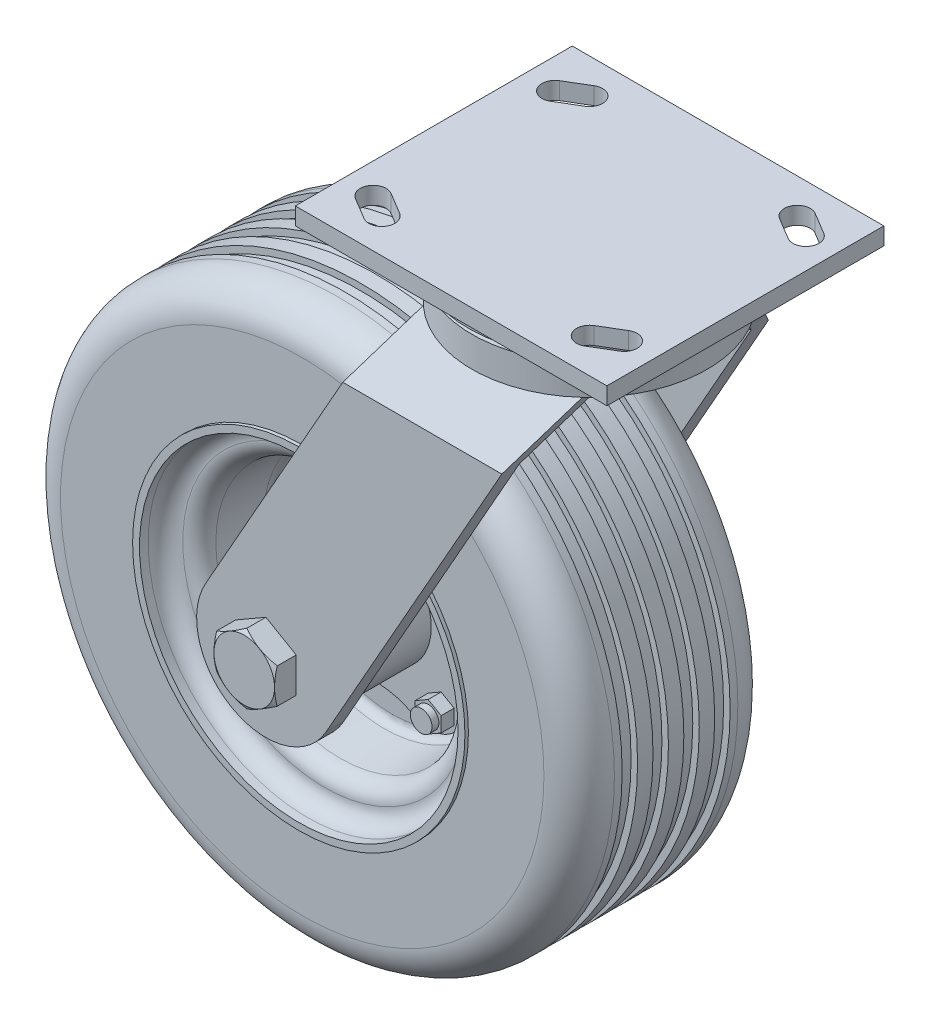
from build123d import *

# Parameters (mm, degrees)
SKETCH1_W               = 114.3
SKETCH1_H               = 6.35
BOSS_EXTRUDE1_DEPTH     = 50.8
F_1_2_HOLES_DEPTH       = 77.727341932
BOSS_EXTRUDE5_DEPTH     = 6.35
BOSS_EXTRUDE6_DEPTH     = 4.7625
SKETCH15_R              = 3.96875
BOSS_EXTRUDE7_DEPTH     = 2.54
SKETCH16_R              = 6.35
BOSS_EXTRUDE8_DEPTH     = 4.7625
SKETCH7_W               = 200.622007455
SKETCH7_H               = 97.79
BOSS_EXTRUDE2_DEPTH     = 225.2599
CUT_EXTRUDE1_START      = -97.79
CUT_EXTRUDE1_DEPTH      = 97.79
CUT_EXTRUDE3_DEPTH      = 230.782863468
CUT_EXTRUDE3_DEPTH_BACK = 230.782863468
SKETCH9_OUTSIDE_W       = 174.676
SKETCH9_OUTSIDE_H       = 325.489
BOSS_EXTRUDE3_DEPTH     = 7.9375
SKETCH11_OUTSIDE_W      = 1426.344
SKETCH11_OUTSIDE_H      = 1450.156
SKETCH11_OUTSIDE_R      = 11.1125
CUT_EXTRUDE4_DEPTH      = 324.561319865
CUT_EXTRUDE4_DRAFT      = -60
SKETCH12_R              = 10.795
BOSS_EXTRUDE4_DEPTH     = 85.09


# Read off the part's stored shape, not the designer's step: Cut-Extrude1
with BuildPart() as part:
    # Sketch1 → Boss-Extrude1 (new, symmetric)
    with BuildSketch(Plane.XY):
        with Locations((0, -3.175)):
            Rectangle(SKETCH1_W, SKETCH1_H)
    extrude(amount=BOSS_EXTRUDE1_DEPTH, both=True)

    # Sketch2 → 1-2 holes (cut, through all)
    with BuildSketch(Plane(origin=(0, 0, 0), x_dir=(1, 0, 0), z_dir=(0, 1, 0))):
        with BuildLine():
            Line((-35.649713965, 34.016189941), (-43.587213965, 29.253689941))
            ThreePointArc((-43.587213965, 29.253689941), (-50.121310059, 30.887213965), (-48.487786035, 37.421310059))
            Line((-48.487786035, 37.421310059), (-40.550286035, 42.183810059))
            ThreePointArc((-40.550286035, 42.183810059), (-34.016189941, 40.550286035), (-35.649713965, 34.016189941))
        make_face()
        with BuildLine():
            Line((-35.649713965, -34.016189941), (-43.587213965, -29.253689941))
            ThreePointArc((-43.587213965, -29.253689941), (-50.121310059, -30.887213965), (-48.487786035, -37.421310059))
            Line((-48.487786035, -37.421310059), (-40.550286035, -42.183810059))
            ThreePointArc((-40.550286035, -42.183810059), (-34.016189941, -40.550286035), (-35.649713965, -34.016189941))
        make_face()
        with BuildLine():
            Line((35.649713965, 34.016189941), (43.587213965, 29.253689941))
            ThreePointArc((43.587213965, 29.253689941), (50.121310059, 30.887213965), (48.487786035, 37.421310059))
            Line((48.487786035, 37.421310059), (40.550286035, 42.183810059))
            ThreePointArc((40.550286035, 42.183810059), (34.016189941, 40.550286035), (35.649713965, 34.016189941))
        make_face()
        with BuildLine():
            Line((35.649713965, -34.016189941), (43.587213965, -29.253689941))
            ThreePointArc((43.587213965, -29.253689941), (50.121310059, -30.887213965), (48.487786035, -37.421310059))
            Line((48.487786035, -37.421310059), (40.550286035, -42.183810059))
            ThreePointArc((40.550286035, -42.183810059), (34.016189941, -40.550286035), (35.649713965, -34.016189941))
        make_face()
    extrude(amount=-F_1_2_HOLES_DEPTH, mode=Mode.SUBTRACT)


with BuildPart() as body_2:
    # Sketch4 → Revolve1 (revolve)
    with BuildSketch(Plane.XY, mode=Mode.PRIVATE) as revolve1_sk:
        Polygon((0, -27.1526), (43.18, -27.1526), (43.18, -16.0401), (40.64, -16.0401), (40.64, -13.5001), (44.45, -13.5001), (44.45, -6.35), (0, -6.35), align=None)
    revolve(revolve1_sk.sketch.rotate(Axis((0, -6.35, 0), (0, -1, 0)), 180), axis=Axis((0, -6.35, 0), (0, -1, 0)))


with BuildPart() as body_3:
    # Sketch6 → Revolve2 (revolve)
    with BuildSketch(Plane(origin=(-69.85, 0, 0), x_dir=(0, 0, -1), z_dir=(1, 0, 0)), mode=Mode.PRIVATE) as revolve2_sk:
        with BuildLine():
            Line((-35.56, -89.8525), (-35.56, -62.143409091))
            ThreePointArc((-35.56, -62.143409091), (-31.772624414, -52.999875586), (-22.629090909, -49.2125))
            Line((-22.629090909, -49.2125), (-19.800454545, -49.2125))
            Line((-19.800454545, -49.2125), (-19.800454545, -51.59375))
            Line((-19.800454545, -51.59375), (-14.143181818, -51.59375))
            Line((-14.143181818, -51.59375), (-14.143181818, -49.2125))
            Line((-14.143181818, -49.2125), (-8.485909091, -49.2125))
            Line((-8.485909091, -49.2125), (-8.485909091, -51.59375))
            Line((-8.485909091, -51.59375), (-2.828636364, -51.59375))
            Line((-2.828636364, -51.59375), (-2.828636364, -49.2125))
            Line((-2.828636364, -49.2125), (2.828636364, -49.2125))
            Line((2.828636364, -49.2125), (2.828636364, -51.59375))
            Line((2.828636364, -51.59375), (8.485909091, -51.59375))
            Line((8.485909091, -51.59375), (8.485909091, -49.2125))
            Line((8.485909091, -49.2125), (14.143181818, -49.2125))
            Line((14.143181818, -49.2125), (14.143181818, -51.59375))
            Line((14.143181818, -51.59375), (19.800454545, -51.59375))
            Line((19.800454545, -51.59375), (19.800454545, -49.2125))
            Line((19.800454545, -49.2125), (22.629090909, -49.2125))
            ThreePointArc((22.629090909, -49.2125), (31.772624414, -52.999875586), (35.56, -62.143409091))
            Line((35.56, -62.143409091), (35.56, -89.8525))
            Line((35.56, -89.8525), (36.83, -89.8525))
            Line((36.83, -89.8525), (36.83, -92.3925))
            Line((36.83, -92.3925), (33.655, -92.3925))
            ThreePointArc((33.655, -92.3925), (29.164871939, -94.252371939), (27.305, -98.7425))
            ThreePointArc((27.305, -98.7425), (25.636711089, -103.032497818), (21.508438966, -105.068336333))
            Line((21.508438966, -105.068336333), (5.438280517, -106.474293018))
            ThreePointArc((5.438280517, -106.474293018), (3.374144456, -107.492212276), (2.54, -109.637211185))
            Line((2.54, -109.637211185), (2.54, -130.175))
            Line((2.54, -130.175), (36.83, -130.175))
            Line((36.83, -130.175), (40.005, -130.175))
            Line((40.005, -130.175), (40.005, -150.8125))
            Line((40.005, -150.8125), (-40.005, -150.8125))
            Line((-40.005, -150.8125), (-40.005, -130.175))
            Line((-40.005, -130.175), (-36.83, -130.175))
            Line((-36.83, -130.175), (-2.54, -130.175))
            Line((-2.54, -130.175), (-2.54, -109.637211185))
            ThreePointArc((-2.54, -109.637211185), (-3.374144456, -107.492212276), (-5.438280517, -106.474293018))
            Line((-5.438280517, -106.474293018), (-21.508438966, -105.068336333))
            ThreePointArc((-21.508438966, -105.068336333), (-25.636711089, -103.032497818), (-27.305, -98.7425))
            ThreePointArc((-27.305, -98.7425), (-29.164871939, -94.252371939), (-33.655, -92.3925))
            Line((-33.655, -92.3925), (-36.83, -92.3925))
            Line((-36.83, -92.3925), (-36.83, -89.8525))
            Line((-36.83, -89.8525), (-35.56, -89.8525))
        make_face()
    revolve(revolve2_sk.sketch.rotate(Axis((-69.85, -150.8125, 111.145303652), (0, 0, -1)), 90), axis=Axis((-69.85, -150.8125, 111.145303652), (0, 0, -1)))

    # Sketch13 → Boss-Extrude5 (add)
    with BuildSketch(Plane.XY.offset(2.54)):
        with BuildLine():
            ThreePointArc((-101.041813407, -136.474589407), (-98.965325939, -121.697174061), (-84.187910593, -119.620686593))
            ThreePointArc((-84.187910593, -119.620686593), (-69.85, -123.329070395), (-55.512089407, -119.620686593))
            ThreePointArc((-55.512089407, -119.620686593), (-40.734674061, -121.697174061), (-38.658186593, -136.474589407))
            ThreePointArc((-38.658186593, -136.474589407), (-42.366570395, -150.8125), (-38.658186593, -165.150410593))
            ThreePointArc((-38.658186593, -165.150410593), (-40.734674061, -179.927825939), (-55.512089407, -182.004313407))
            ThreePointArc((-55.512089407, -182.004313407), (-69.85, -178.295929605), (-84.187910593, -182.004313407))
            ThreePointArc((-84.187910593, -182.004313407), (-98.965325939, -179.927825939), (-101.041813407, -165.150410593))
            ThreePointArc((-101.041813407, -165.150410593), (-97.333429605, -150.8125), (-101.041813407, -136.474589407))
        make_face()
    extrude(amount=BOSS_EXTRUDE5_DEPTH)

    # Sketch14 → Boss-Extrude6 (add)
    with BuildSketch(Plane.XY.offset(8.89)):
        Polygon((-94.124522691, -132.037238623), (-89.362022691, -129.287607966), (-89.362022691, -123.788346652), (-94.124522691, -121.038715995), (-98.887022691, -123.788346652), (-98.887022691, -129.287607966), align=None)
        Polygon((-40.812977309, -129.287607966), (-45.575477309, -132.037238623), (-50.337977309, -129.287607966), (-50.337977309, -123.788346652), (-45.575477309, -121.038715995), (-40.812977309, -123.788346652), align=None)
        Polygon((-45.575477309, -169.587761377), (-50.337977309, -172.337392034), (-50.337977309, -177.836653348), (-45.575477309, -180.586284005), (-40.812977309, -177.836653348), (-40.812977309, -172.337392034), align=None)
        Polygon((-98.887022691, -172.337392034), (-94.124522691, -169.587761377), (-89.362022691, -172.337392034), (-89.362022691, -177.836653348), (-94.124522691, -180.586284005), (-98.887022691, -177.836653348), align=None)
    extrude(amount=BOSS_EXTRUDE6_DEPTH)

    # Sketch15 → Boss-Extrude7 (add)
    with BuildSketch(Plane.XY.offset(13.6525)):
        with Locations((-94.124522691, -126.537977309)):
            Circle(SKETCH15_R)
        with Locations(Location((-45.575477309, -126.537977309, 0), (0, 0, 180))):
            Circle(SKETCH15_R)
        with Locations(Location((-94.124522691, -175.087022691, 0), (0, 0, 180))):
            Circle(SKETCH15_R)
        with Locations((-45.575477309, -175.087022691)):
            Circle(SKETCH15_R)
    extrude(amount=BOSS_EXTRUDE7_DEPTH)

    # Sketch16 → Boss-Extrude8 (add)
    with BuildSketch(Plane(origin=(0, 0, -2.54), x_dir=(-1, 0, 0), z_dir=(0, 0, -1))):
        with Locations(Location((45.575477309, -126.537977309, 0), (0, 0, 180))):
            Circle(SKETCH16_R)
        with Locations(Location((94.124522691, -126.537977309, 0), (0, 0, 180))):
            Circle(SKETCH16_R)
        with Locations(Location((94.124522691, -175.087022691, 0), (0, 0, 180))):
            Circle(SKETCH16_R)
        with Locations(Location((45.575477309, -175.087022691, 0), (0, 0, 180))):
            Circle(SKETCH16_R)
    extrude(amount=BOSS_EXTRUDE8_DEPTH)


with BuildPart() as body_4:
    # Sketch7 → Boss-Extrude2 (new body)
    with BuildSketch(Plane.XZ.offset(27.1526)):
        with Locations((-71.138996273, 0)):
            Rectangle(SKETCH7_W, SKETCH7_H)
    extrude(amount=BOSS_EXTRUDE2_DEPTH)

    # Cut-Extrude1 outline → Cut-Extrude1 (cut)
    with BuildSketch(Plane.XY.offset(48.895).offset(CUT_EXTRUDE1_START)):
        with BuildLine():
            Line((29.172007455, -27.1526), (-47.734278242, -163.304691606))
            ThreePointArc((-47.734278242, -163.304691606), (-82.342191606, -172.928221758), (-91.965721758, -138.320308394))
            Line((-91.965721758, -138.320308394), (-29.172007455, -27.1526))
            Line((-29.172007455, -27.1526), (-171.45, -27.1526))
            Line((-171.45, -27.1526), (-171.45, -252.4125))
            Line((-171.45, -252.4125), (29.172007455, -252.4125))
            Line((29.172007455, -252.4125), (29.172007455, -27.1526))
        make_face()
    extrude(amount=CUT_EXTRUDE1_DEPTH, mode=Mode.SUBTRACT)

    # Sketch9 outside → Cut-Extrude3 (cut, two sides: drawn at the far end of the back side and taken through both)
    with BuildSketch(Plane(origin=(0, -144.306693689, 0), x_dir=(0, 0, -1), z_dir=(-1, 0, 0)).offset(-CUT_EXTRUDE3_DEPTH_BACK)):
        with Locations((0, -18.1005)):
            Rectangle(SKETCH9_OUTSIDE_W, SKETCH9_OUTSIDE_H)
        Polygon((48.895, 108.105806311), (48.895, -95.094193689), (31.835614978, -117.154093689), (25.485614978, -117.154093689), (42.545, -95.094193689), (42.545, 108.105806311), align=None, mode=Mode.SUBTRACT)
        Polygon((-25.485614978, -117.154093689), (-31.835614978, -117.154093689), (-48.895, -95.094193689), (-48.895, 108.105806311), (-42.545, 108.105806311), (-42.545, -95.094193689), align=None, mode=Mode.SUBTRACT)
    extrude(amount=CUT_EXTRUDE3_DEPTH + CUT_EXTRUDE3_DEPTH_BACK, mode=Mode.SUBTRACT)


with BuildPart() as cut_extrude3_piece_1:
    # of the separate pieces the step leaves, piece 1, a body of its own (cut_extrude3_pieces)
    add(body_4.part.solids().sort_by_distance((29.172007455, -27.1526, -31.835614978))[0])



with BuildPart() as cut_extrude3_piece_2:
    # of the separate pieces the step leaves, piece 2, a body of its own (cut_extrude3_pieces)
    add(body_4.part.solids().sort_by_distance((16.711347087, -49.2125, 48.895))[0])


with BuildPart() as body_6:
    # Sketch10 → Boss-Extrude3 (new body)
    with BuildSketch(Plane.XY.offset(48.895)):
        Polygon((-69.85, -137.980890267), (-80.9625, -144.396695134), (-80.9625, -157.228304866), (-69.85, -163.644109733), (-58.7375, -157.228304866), (-58.7375, -144.396695134), align=None)
    extrude(amount=BOSS_EXTRUDE3_DEPTH)


with BuildPart() as cut_extrude4_tool:
    # Sketch11 outside → Cut-Extrude4 (with draft: the straight prism first)
    with BuildSketch(Plane.XY.offset(56.8325)):
        with Locations((-57.15, -126.206)):
            Rectangle(SKETCH11_OUTSIDE_W, SKETCH11_OUTSIDE_H)
        with Locations((-69.85, -150.8125)):
            Circle(SKETCH11_OUTSIDE_R, mode=Mode.SUBTRACT)
    extrude(amount=-CUT_EXTRUDE4_DEPTH)
    # Cut-Extrude4: the draft: its side faces are tilted about the plane it starts from
    cut_extrude4_sides = [cut_extrude4_tool.faces().sort_by_distance(p)[0] for p in [
        (-57.15, -851.284, -105.448159932),
        (656.022, -126.206, -105.448159932),
        (-57.15, 598.872, -105.448159932),
        (-770.322, -126.206, -105.448159932),
        (-80.9625, -150.8125, -105.448159932),
    ]]
    draft(cut_extrude4_sides, Plane.XY.offset(56.8325), CUT_EXTRUDE4_DRAFT)


with BuildPart() as body_6_1:
    add(body_6.part)

    # Cut-Extrude4: cut by cut_extrude4_tool
    add(cut_extrude4_tool.part, mode=Mode.SUBTRACT)


with BuildPart() as body_7:
    # Mirror1: mirrored copy
    add(body_6_1.part.mirror(Plane.XY))


with BuildPart() as cut_extrude3_piece_1_1:
    add(cut_extrude3_piece_1.part)

    add(cut_extrude3_piece_2.part)  # Boss-Extrude4 merges Cut-Extrude3 piece 2
    # Sketch12 → Boss-Extrude4 (add)
    with BuildSketch(Plane.XY.offset(-42.545)):
        with Locations(Location((-69.85, -150.8125, 0), (0, 0, 180))):
            Circle(SKETCH12_R)
    extrude(amount=BOSS_EXTRUDE4_DEPTH)

    # Combine1: union body 7, body 6, body 2, part
    add(body_7.part)
    add(body_6_1.part)
    add(body_2.part)
    add(part.part)


solid = Compound([body_3.part, cut_extrude3_piece_1_1.part])
